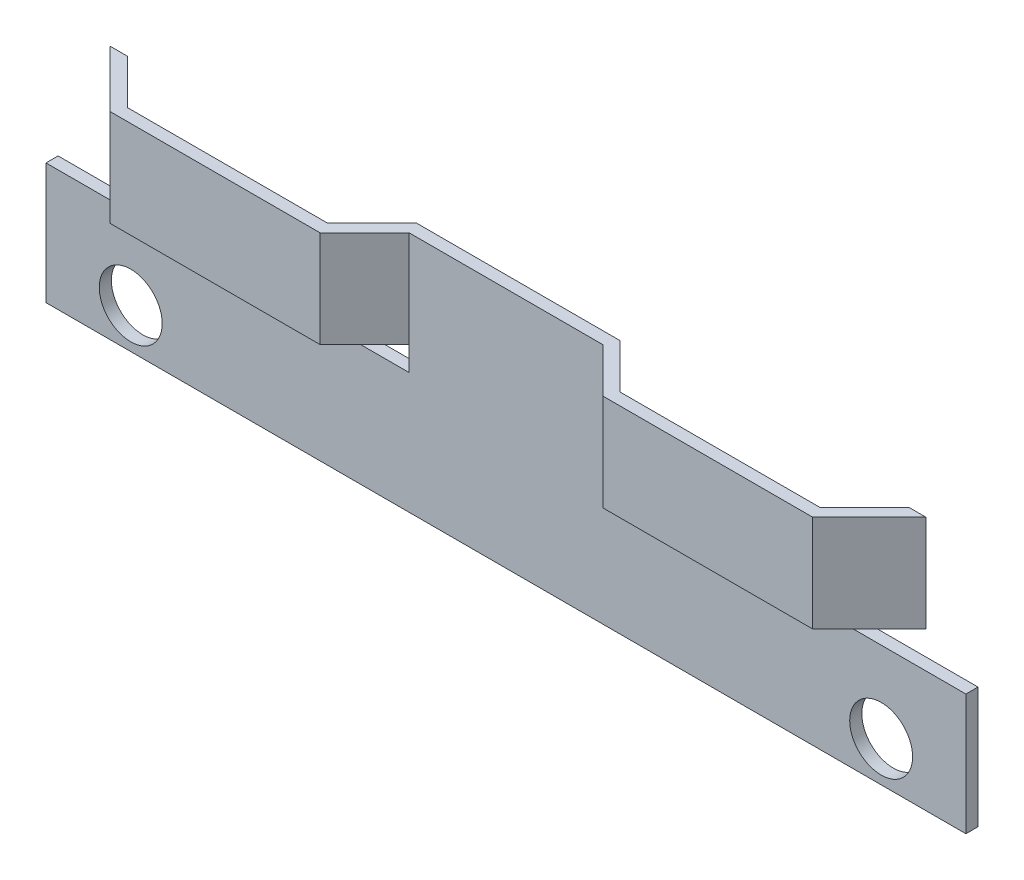
from build123d import *

# Parameters (mm, degrees)
SKETCH1_W           = 76
SKETCH1_H           = 20
BASE_FLANGE1_DEPTH  = 1
SKETCH6_R           = 2.6
CUT_EXTRUDE1_DEPTH  = 10
SKETCH7_W           = 30
SKETCH7_H           = 10
CUT_EXTRUDE2_DEPTH  = 10
BOSS_EXTRUDE1_DEPTH = 8


# Sheet-metal steps are written as plain solids
with BuildPart() as part:
    # Sketch1 → Base-Flange1 (new body)
    with BuildSketch(Plane.XY):
        Rectangle(SKETCH1_W, SKETCH1_H)
    extrude(amount=-BASE_FLANGE1_DEPTH)

    # Sketch6 → Cut-Extrude1 (cut)
    with BuildSketch(Plane.XY):
        with Locations((-31, -6.7)):
            Circle(SKETCH6_R)
        with Locations(Location((31, -6.7, 0), (0, 0, 180))):
            Circle(SKETCH6_R)
    extrude(amount=-CUT_EXTRUDE1_DEPTH, mode=Mode.SUBTRACT)

    # Sketch7 → Cut-Extrude2 (cut)
    with BuildSketch(Plane.XY):
        with Locations((-23, 5)):
            Rectangle(SKETCH7_W, SKETCH7_H)
        with Locations((23, 5)):
            Rectangle(SKETCH7_W, SKETCH7_H)
    extrude(amount=-CUT_EXTRUDE2_DEPTH, mode=Mode.SUBTRACT)

    # Sketch8 → Boss-Extrude1 (add)
    with BuildSketch(Plane(origin=(0, 10, 0), x_dir=(1, 0, 0), z_dir=(0, 1, 0))):
        Polygon((8, 0), (11.67711212, -3.67711212), (29.020618382, -3.67711212), (33.697730502, 1), (32.28351694, 1), (28.60640482, -2.67711212), (12.091325682, -2.67711212), (8.414213562, 1), (8, 1), align=None)
        Polygon((-32.28351694, 1), (-33.697730502, 1), (-29.020618382, -3.67711212), (-11.67711212, -3.67711212), (-8, 0), (-8, 1), (-8.414213562, 1), (-12.091325682, -2.67711212), (-28.60640482, -2.67711212), align=None)
    extrude(amount=-BOSS_EXTRUDE1_DEPTH)


solid = part.part
